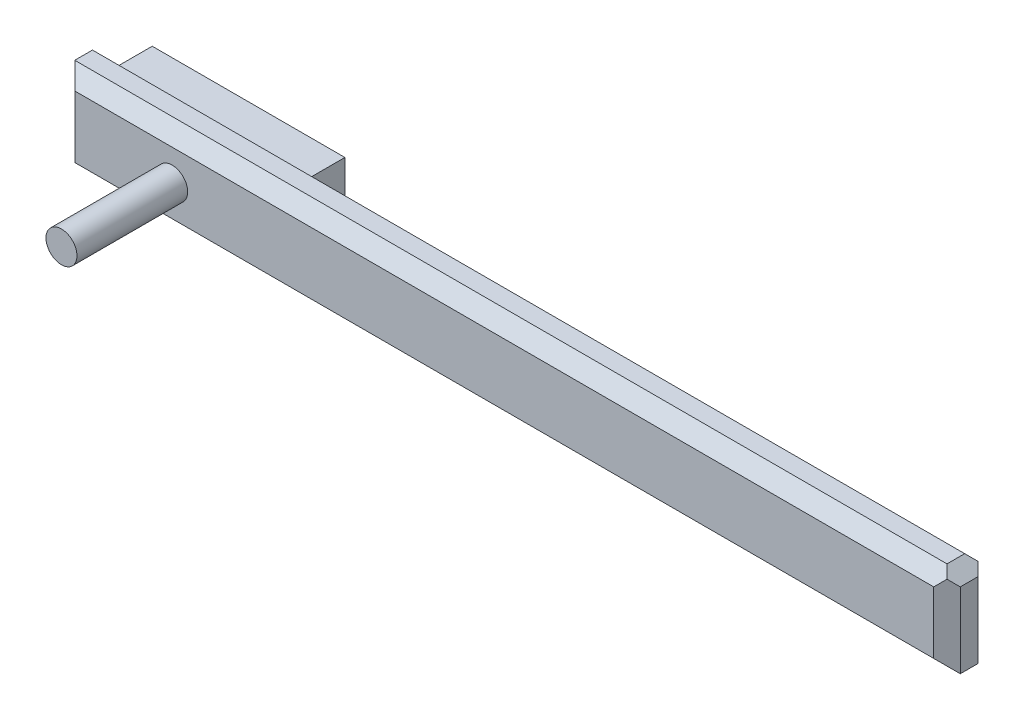
from build123d import *

# Parameters (mm, degrees)
SKETCH1_W           = 20
SKETCH1_H           = 2
BOSS_EXTRUDE1_DEPTH = 1
SKETCH2_R           = 0.35
BOSS_EXTRUDE3_DEPTH = 2.5
CHAMFER2_SIZE       = 0.3
CHAMFER4_SIZE       = 0.3
CHAMFER5_SIZE       = 0.3
SKETCH4_W           = 4.351090726
SKETCH4_H           = 1.4
BOSS_EXTRUDE4_DEPTH = 0.75


with BuildPart() as part:
    # Sketch1 → Boss-Extrude1 (new body)
    with BuildSketch(Plane.XY):
        Rectangle(SKETCH1_W, SKETCH1_H)
    extrude(amount=BOSS_EXTRUDE1_DEPTH)

    # Sketch2 → Boss-Extrude3 (add)
    with BuildSketch(Plane.XY.offset(1)):
        with Locations((-7.5, 0)):
            Circle(SKETCH2_R)
    extrude(amount=BOSS_EXTRUDE3_DEPTH)

    # Chamfer2
    chamfer2_edges = [part.edges().sort_by_distance(p)[0] for p in [
        (10, 1, 0.5),
    ]]
    chamfer(chamfer2_edges, length=CHAMFER2_SIZE)

    # Chamfer4
    # the kernel refuses this chamfer: 0.3 mm, written as the material it takes off along each edge
    with BuildSketch(Plane(origin=(10, 1.471504896, 0), x_dir=(-0.9996219169112968, 0, -0.02749587661058633), z_dir=(0, -1, 0))) as chamfer4_piece_1:
        Polygon((CHAMFER4_SIZE * 0.999621916911, -CHAMFER4_SIZE * 0.0274958766106), (-CHAMFER4_SIZE * 0.0274958766106, -CHAMFER4_SIZE * 0.999621916911), (0, 0), align=None)
    extrude(amount=3.243009793, mode=Mode.SUBTRACT)
    with BuildSketch(Plane(origin=(10, 1.471504896, 1), x_dir=(-0.9996219169112968, 0, 0.027495876610586622), z_dir=(0, -1, 0))) as chamfer4_piece_2:
        Polygon((CHAMFER4_SIZE * 0.999621916911, CHAMFER4_SIZE * 0.0274958766106), (-CHAMFER4_SIZE * 0.0274958766106, CHAMFER4_SIZE * 0.999621916911), (0, 0), align=None)
    extrude(amount=3.243009793, mode=Mode.SUBTRACT)
    with BuildSketch(Plane(origin=(10.771504896, -1, 1), x_dir=(0, 0.9996219169112968, 0.027495876610586632), z_dir=(-1, 0, 0))) as chamfer4_piece_3:
        Polygon((CHAMFER4_SIZE * 0.999621916911, CHAMFER4_SIZE * 0.0274958766106), (-CHAMFER4_SIZE * 0.0274958766106, CHAMFER4_SIZE * 0.999621916911), (0, 0), align=None)
    extrude(amount=21.543009793, mode=Mode.SUBTRACT)
    with BuildSketch(Plane(origin=(-10.771504896, 1, 0), x_dir=(0, 0.027495876610586632, 0.9996219169112968), z_dir=(1, 0, 0))) as chamfer4_piece_4:
        Polygon((CHAMFER4_SIZE * 0.999621916911, CHAMFER4_SIZE * 0.0274958766106), (-CHAMFER4_SIZE * 0.0274958766106, CHAMFER4_SIZE * 0.999621916911), (0, 0), align=None)
    extrude(amount=21.243009793, mode=Mode.SUBTRACT)
    with BuildSketch(Plane(origin=(-10.771504896, 1, 1), x_dir=(0, 0.027495876610586632, -0.9996219169112968), z_dir=(1, 0, 0))) as chamfer4_piece_5:
        Polygon((CHAMFER4_SIZE * 0.999621916911, -CHAMFER4_SIZE * 0.0274958766106), (-CHAMFER4_SIZE * 0.0274958766106, -CHAMFER4_SIZE * 0.999621916911), (0, 0), align=None)
    extrude(amount=21.243009793, mode=Mode.SUBTRACT)

    # Chamfer5
    chamfer5_edges = [part.edges().sort_by_distance(p)[0] for p in [
        (-10, 0, 1),
        (-10, -0.15, 0),
        (-0.15, -1, 0),
    ]]
    chamfer(chamfer5_edges, length=CHAMFER5_SIZE)

    # Sketch4 → Boss-Extrude4 (add)
    with BuildSketch(Plane(origin=(0, 0, 0), x_dir=(-1, 0, 0), z_dir=(0, 0, -1))):
        with Locations((7.524454637, 0)):
            Rectangle(SKETCH4_W, SKETCH4_H)
    extrude(amount=BOSS_EXTRUDE4_DEPTH)


solid = part.part
